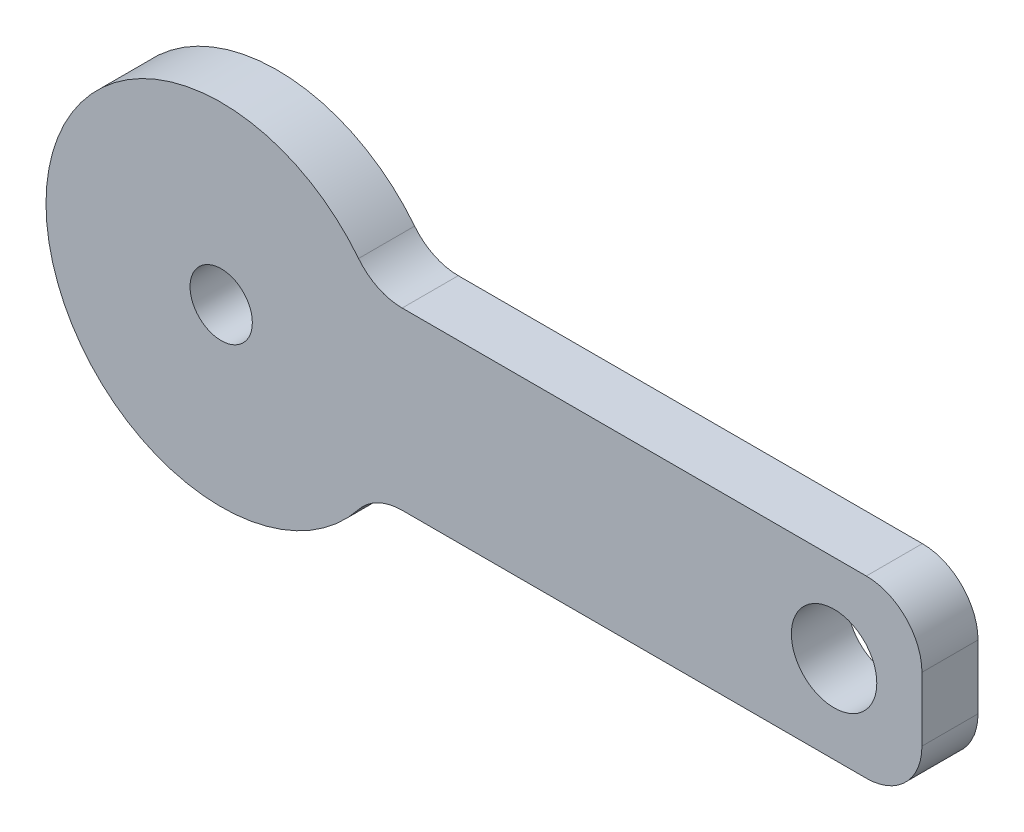
from build123d import *

# Parameters (mm, degrees)
BOSS_EXTRUDE1_DEPTH   = 1.6002
F_0_CLEARANCE_HOLE1_D = 1.778
F_2_CLEARANCE_HOLE1_D = 2.4384


with BuildPart() as part:
    # Sketch1 → Boss-Extrude1 (new body)
    with BuildSketch(Plane.XY):
        with BuildLine():
            Line((5.16599458, -2.5), (18.4125, -2.5))
            ThreePointArc((18.4125, -2.5), (19.535032015, -2.035032015), (20, -0.9125))
            Line((20, -0.9125), (20, 0.9125))
            ThreePointArc((20, 0.9125), (19.535032015, 2.035032015), (18.4125, 2.5))
            Line((18.4125, 2.5), (5.16599458, 2.5))
            ThreePointArc((5.16599458, 2.5), (4.474468718, 2.658532459), (3.921058505, 3.102466793))
            ThreePointArc((3.921058505, 3.102466793), (-5, 0), (3.921058505, -3.102466793))
            ThreePointArc((3.921058505, -3.102466793), (4.474468718, -2.658532459), (5.16599458, -2.5))
        make_face()
    extrude(amount=BOSS_EXTRUDE1_DEPTH)

    # #0 Clearance Hole1 (through all)
    with Locations(Plane.XY.offset(1.6002)):
        with Locations((0, 0)):
            Hole(F_0_CLEARANCE_HOLE1_D / 2)

    # #2 Clearance Hole1 (through all)
    with Locations(Plane.XY.offset(1.6002)):
        with Locations((17.492583456, 0)):
            Hole(F_2_CLEARANCE_HOLE1_D / 2)


solid = part.part
